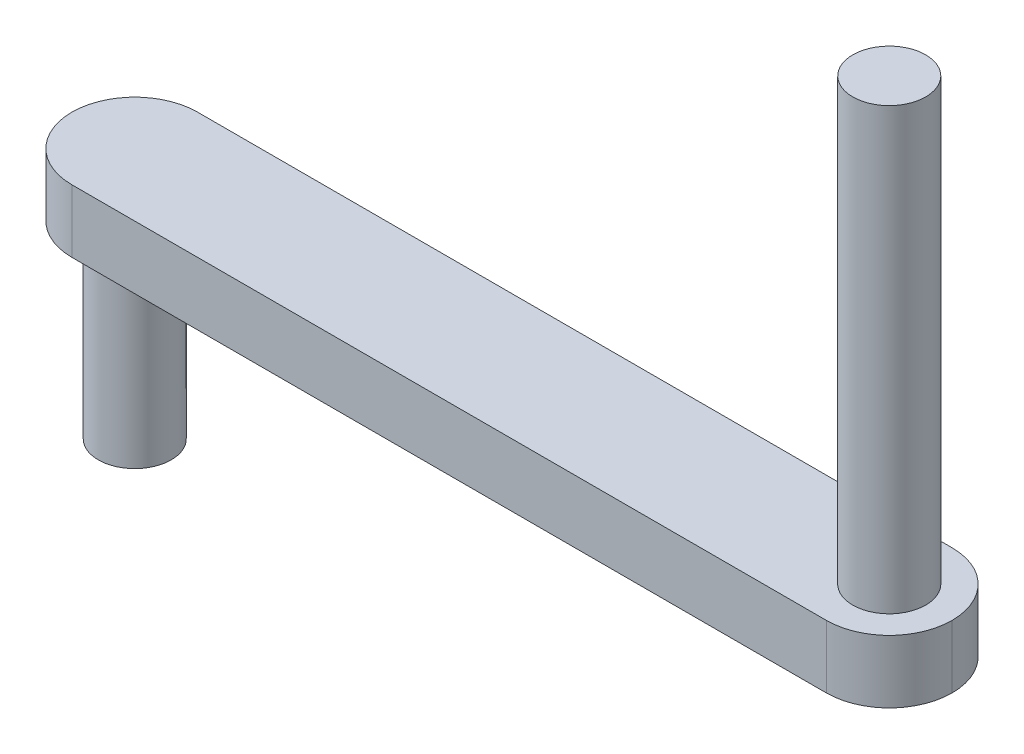
from build123d import *

# Parameters (mm, degrees)
SKETCH1_W           = 70
SKETCH1_H           = 10
BOSS_EXTRUDE1_DEPTH = 5
FILLET1_R           = 5
SKETCH2_R           = 2.9
BOSS_EXTRUDE2_DEPTH = 15
SKETCH3_R           = 2.9
BOSS_EXTRUDE3_DEPTH = 35


with BuildPart() as part:
    # Sketch1 → Boss-Extrude1 (new body)
    with BuildSketch(Plane(origin=(0, 0, 0), x_dir=(1, 0, 0), z_dir=(0, 1, 0))):
        with Locations((35, 5)):
            Rectangle(SKETCH1_W, SKETCH1_H)
    extrude(amount=BOSS_EXTRUDE1_DEPTH)

    # Fillet1
    fillet1_edges = [part.edges().sort_by_distance(p)[0] for p in [
        (70, 2.5, -10),
        (70, 2.5, 0),
        (0, 2.5, -10),
        (0, 2.5, 0),
    ]]
    fillet(fillet1_edges, radius=FILLET1_R - 0.0001)  # a hair under: the kernel refuses the full size

    # Sketch2 → Boss-Extrude2 (add)
    with BuildSketch(Plane.XZ):
        with Locations(Location((5, -5, 0), (0, 0, 270))):
            Circle(SKETCH2_R)
    extrude(amount=BOSS_EXTRUDE2_DEPTH)

    # Sketch3 → Boss-Extrude3 (add)
    with BuildSketch(Plane(origin=(0, 5, 0), x_dir=(1, 0, 0), z_dir=(0, 1, 0))):
        with Locations(Location((65, 5, 0), (0, 0, 270))):
            Circle(SKETCH3_R)
    extrude(amount=BOSS_EXTRUDE3_DEPTH)


solid = part.part
